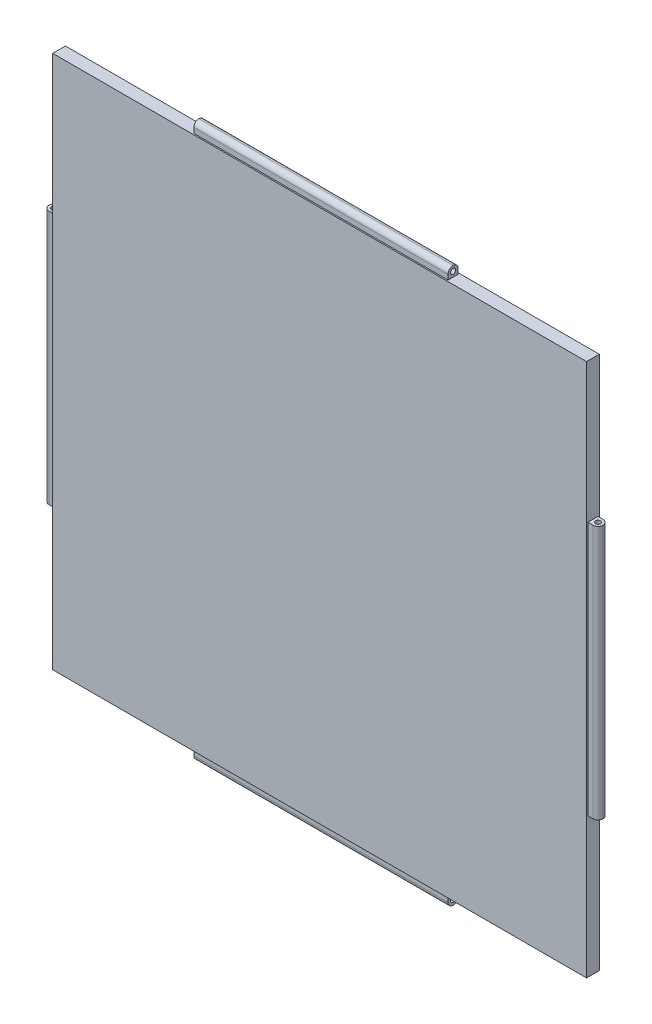
from build123d import *

# Parameters (mm, degrees)
SKETCH_1_W             = 420
SKETCH_1_H             = 420
EXTRUDE_1_DEPTH        = 10
SKETCH_2_W             = 200
SKETCH_2_H             = 8
EXTRUDE_2_DEPTH        = 8
CUT_EXTRUDE_1_REACH    = 381.109
SKETCH_3_R             = 2
FILLET_1_R             = 4
FILLET_1_OF_MIRROR_1_R = 4
SKETCH_4_W             = 8
SKETCH_4_H             = 200
EXTRUDE_3_DEPTH        = 8
FILLET_2_R             = 4
CUT_EXTRUDE_2_REACH    = 387.679
SKETCH_5_R             = 2
FILLET_2_OF_MIRROR_3_R = 4


with BuildPart() as part:
    # 草图1 → 凸台-拉伸1 (new body)
    with BuildSketch(Plane.XY):
        Rectangle(SKETCH_1_W, SKETCH_1_H)
    extrude_1 = extrude(amount=EXTRUDE_1_DEPTH)

    # 草图2 → 凸台-拉伸2 (add)
    with BuildSketch(Plane(origin=(0, 210, 0), x_dir=(1, 0, 0), z_dir=(0, 1, 0))):
        with Locations((0, -5)):
            Rectangle(SKETCH_2_W, SKETCH_2_H)
    extrude_2 = extrude(amount=EXTRUDE_2_DEPTH)

    # 草图3 → 切除-拉伸1 (cut, up to next)
    with BuildSketch(Plane(origin=(100, 0, 0), x_dir=(0, 0, -1), z_dir=(1, 0, 0)), mode=Mode.PRIVATE) as cut_extrude_1_sk1:
        with Locations((-5, 214)):
            Circle(SKETCH_3_R)
    cut_extrude_1_tool1 = extrude(cut_extrude_1_sk1.sketch, amount=-CUT_EXTRUDE_1_REACH, mode=Mode.PRIVATE) & part.part
    cut_extrude_1 = cut_extrude_1_tool1.solids().sort_by_distance((100, 214, 5))[0]
    add(cut_extrude_1, mode=Mode.SUBTRACT)

    # 圆角1
    fillet_1_edges = [part.edges().sort_by_distance(p)[0] for p in [
        (0, 218, 1),
        (0, 218, 9),
    ]]
    fillet(fillet_1_edges, radius=FILLET_1_R - 0.0001)  # a hair under: the kernel refuses the full size

    # 镜向1: 凸台-拉伸1, 凸台-拉伸2, 切除-拉伸1 across plane
    add(extrude_1.mirror(Plane.ZX))
    add(extrude_2.mirror(Plane.ZX))
    add(cut_extrude_1.mirror(Plane.ZX), mode=Mode.SUBTRACT)

    # 圆角1 of 镜向1
    fillet_1_of_mirror_1_edges = [part.edges().sort_by_distance(p)[0] for p in [
        (0, -218, 1),
        (0, -218, 9),
    ]]
    fillet(fillet_1_of_mirror_1_edges, radius=FILLET_1_OF_MIRROR_1_R - 0.0001)  # a hair under: the kernel refuses the full size

    # 草图4 → 凸台-拉伸3 (add)
    with BuildSketch(Plane.ZY.offset(210)):
        with Locations((5, 0)):
            Rectangle(SKETCH_4_W, SKETCH_4_H)
    extrude_3 = extrude(amount=EXTRUDE_3_DEPTH)

    # 圆角2
    fillet_2_edges = [part.edges().sort_by_distance(p)[0] for p in [
        (-218, 0, 9),
        (-218, 0, 1),
    ]]
    fillet(fillet_2_edges, radius=FILLET_2_R - 0.0001)  # a hair under: the kernel refuses the full size

    # 草图5 → 切除-拉伸2 (cut, up to next)
    with BuildSketch(Plane.XZ.offset(100), mode=Mode.PRIVATE) as cut_extrude_2_sk1:
        with Locations(Location((-214, 5, 0), (0, 0, 270))):
            Circle(SKETCH_5_R)
    cut_extrude_2_tool1 = extrude(cut_extrude_2_sk1.sketch, amount=-CUT_EXTRUDE_2_REACH, mode=Mode.PRIVATE) & part.part
    cut_extrude_2 = cut_extrude_2_tool1.solids().sort_by_distance((-214, -100, 5))[0]
    add(cut_extrude_2, mode=Mode.SUBTRACT)

    # 镜向3: 凸台-拉伸3, 切除-拉伸2 across plane
    add(extrude_3.mirror(Plane(origin=(0, 0, 0), x_dir=(0, 0, 1), z_dir=(1, 0, 0))))
    add(cut_extrude_2.mirror(Plane(origin=(0, 0, 0), x_dir=(0, 0, 1), z_dir=(1, 0, 0))), mode=Mode.SUBTRACT)

    # 圆角2 of 镜向3
    fillet_2_of_mirror_3_edges = [part.edges().sort_by_distance(p)[0] for p in [
        (218, 0, 9),
        (218, 0, 1),
    ]]
    fillet(fillet_2_of_mirror_3_edges, radius=FILLET_2_OF_MIRROR_3_R - 0.0001)  # a hair under: the kernel refuses the full size


solid = part.part
